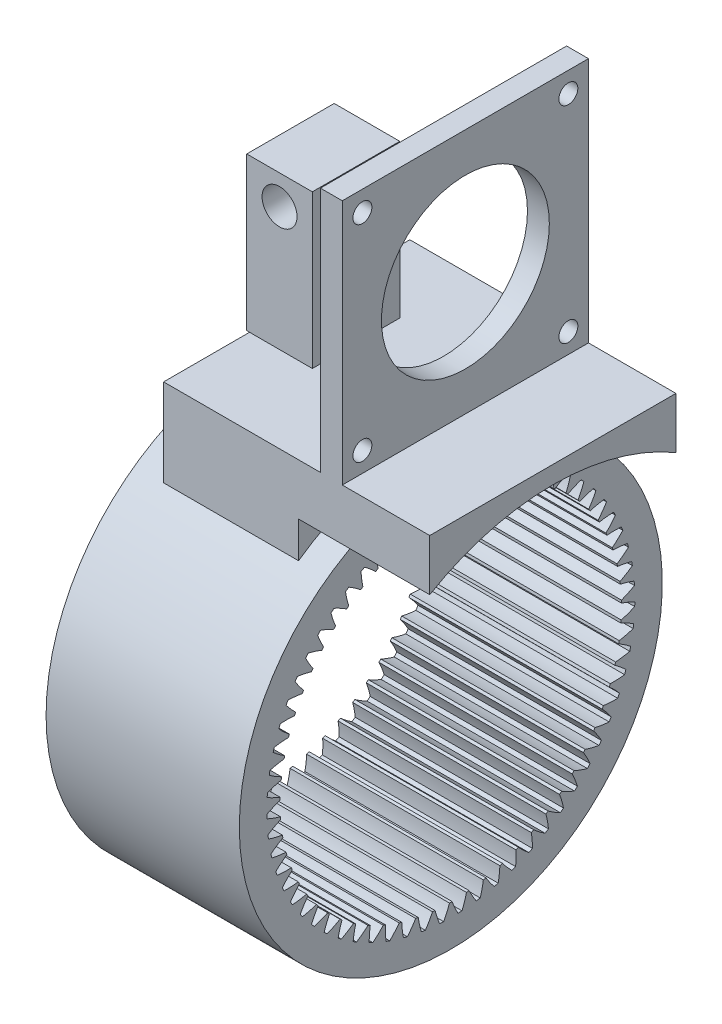
from build123d import *

# Parameters (mm, degrees)
BASPROSKE_W         = 32.815
BASPROSKE_H         = 2.2764
TOOTHCUT_DEPTH      = 56.074954552
TEETHCUTS_COUNT     = 63
SCALE1_SCALE        = 2
SKETCH2_R           = 72.5528
SKETCH2_R_2         = 62.5528
BOSS_EXTRUDE1_DEPTH = 65.63
SCALE2_SCALE        = 1.1
SCALE3_SCALE        = 1.01
SCALE4_SCALE        = 0.99009901
SCALE5_SCALE        = 0.909090909
SCALE6_SCALE        = 1.01
SKETCH3_R           = 73.278328
SKETCH3_R_2         = 72.5528
CUT_EXTRUDE1_DEPTH  = 124.017479557
BOSS_EXTRUDE2_START = -46.2863
BOSS_EXTRUDE2_DEPTH = 46.2863
SCALE7_SCALE        = 0.666666667
BOSS_EXTRUDE3_DEPTH = 30
SKETCH18_W          = 56.3
SKETCH18_H          = 56.3
SKETCH18_R          = 2.165
SKETCH18_R_2        = 19.2
BOSS_EXTRUDE4_DEPTH = 5
SKETCH19_W          = 15
SKETCH19_H          = 35
SKETCH19_R          = 4
BOSS_EXTRUDE5_DEPTH = 10


with BuildPart() as part:
    # BasProSke → Base-Revolve (revolve)
    with BuildSketch(Plane(origin=(0, 0, 0), x_dir=(1, 0, 0), z_dir=(0, 1, 0))):
        with Locations((16.4075, 30.1382)):
            Rectangle(BASPROSKE_W, BASPROSKE_H)
    revolve(axis=Axis((-10, 0, 0), (1, 0, 0)))

    # TooCutSke → ToothCut (cut, through all)
    with BuildSketch(Plane(origin=(0, 0, 0), x_dir=(0, 0, -1), z_dir=(1, 0, 0))):
        with BuildLine():
            ThreePointArc((1.227357706, 28.948593027), (0.830805794, 30.117149174), (0.339543276, 31.24915537))
            ThreePointArc((0.339543276, 31.24915537), (0, 31.251), (-0.339543276, 31.24915537))
            ThreePointArc((-0.339543276, 31.24915537), (-0.830805794, 30.117149174), (-1.227357706, 28.948593027))
            ThreePointArc((-1.227357706, 28.948593027), (0, 28.9746), (1.227357706, 28.948593027))
        make_face()
    toothcut = extrude(amount=TOOTHCUT_DEPTH, mode=Mode.SUBTRACT)

    # TeethCuts: ToothCut ×63 about axis
    teethcuts_axis = Axis((-10, 0, 0), (1, 0, 0))
    for i in range(1, TEETHCUTS_COUNT):
        add(toothcut.rotate(teethcuts_axis, i * 360 / TEETHCUTS_COUNT), mode=Mode.SUBTRACT)


with BuildPart() as part_1:
    # Scale1: scaled about (16.4075, 0, 0)
    add(part.part.scale(SCALE1_SCALE).moved(Location((-16.4075, 0, 0))))

    # Sketch2 → Boss-Extrude1 (add)
    with BuildSketch(Plane(origin=(49.2225, 0, 0), x_dir=(0, 0, -1), z_dir=(1, 0, 0))):
        Circle(SKETCH2_R)
        Circle(SKETCH2_R_2, mode=Mode.SUBTRACT)
    extrude(amount=-BOSS_EXTRUDE1_DEPTH)


with BuildPart() as part_2:
    # Scale2: scaled about (16.4075, 0, 0)
    add(part_1.part.scale(SCALE2_SCALE).moved(Location((-1.64075, 0, 0))))


with BuildPart() as part_3:
    # Scale3: scaled about (16.4075, 0, 0)
    add(part_2.part.scale(SCALE3_SCALE).moved(Location((-0.164075, 0, 0))))


with BuildPart() as part_4:
    # Scale4: scaled about (16.4075, 0, 0)
    add(part_3.part.scale(SCALE4_SCALE).moved(Location((0.162450495, 0, 0))))


with BuildPart() as part_5:
    # Scale5: scaled about (16.4075, 0, 0)
    add(part_4.part.scale(SCALE5_SCALE).moved(Location((1.491590909, 0, 0))))


with BuildPart() as part_6:
    # Scale6: scaled about (16.4075, 0, 0)
    add(part_5.part.scale(SCALE6_SCALE).moved(Location((-0.164075, 0, 0))))

    # Sketch3 → Cut-Extrude1 (cut, through all)
    with BuildSketch(Plane.ZY.offset(16.73565)):
        Circle(SKETCH3_R)
        Circle(SKETCH3_R_2, mode=Mode.SUBTRACT)
    extrude(amount=-CUT_EXTRUDE1_DEPTH, mode=Mode.SUBTRACT)

    # Sketch4 → Boss-Extrude2 (add)
    with BuildSketch(Plane(origin=(39.55065, 0, 0), x_dir=(0, 0, -1), z_dir=(1, 0, 0)).offset(BOSS_EXTRUDE2_START)):
        with BuildLine():
            Line((-42.225, 88.999645447), (-42.225, 58.999645447))
            ThreePointArc((-42.225, 58.999645447), (0, 72.5528), (42.225, 58.999645447))
            Line((42.225, 58.999645447), (42.225, 88.999645447))
            Line((42.225, 88.999645447), (-42.225, 88.999645447))
        make_face()
    extrude(amount=BOSS_EXTRUDE2_DEPTH)


with BuildPart() as part_7:
    # Scale7: scaled about (16.4075, 15.874619557, 0)
    add(part_6.part.scale(SCALE7_SCALE).moved(Location((5.469166667, 5.291539852, 0))))

    # Sketch17 → Boss-Extrude3 (add)
    with BuildSketch(Plane(origin=(31.836266667, 0, 0), x_dir=(0, 0, -1), z_dir=(1, 0, 0))):
        with BuildLine():
            Line((-28.15, 52.896609404), (-28.15, 64.624636817))
            Line((-28.15, 64.624636817), (28.15, 64.624636817))
            Line((28.15, 64.624636817), (28.15, 52.896609404))
            ThreePointArc((28.15, 52.896609404), (0, 60.596739852), (-28.15, 52.896609404))
        make_face()
    extrude(amount=BOSS_EXTRUDE3_DEPTH)

    # Sketch18 → Boss-Extrude4 (add)
    with BuildSketch(Plane(origin=(41.836266667, 0, 0), x_dir=(0, 0, -1), z_dir=(1, 0, 0))):
        with Locations((0, 92.774636817)):
            Rectangle(SKETCH18_W, SKETCH18_H)
        with Locations((-23.55, 116.277331248)):
            Circle(SKETCH18_R, mode=Mode.SUBTRACT)
        with Locations((23.55, 116.277331248)):
            Circle(SKETCH18_R, mode=Mode.SUBTRACT)
        with Locations((-23.55, 69.177331248)):
            Circle(SKETCH18_R, mode=Mode.SUBTRACT)
        with Locations((23.55, 69.177331248)):
            Circle(SKETCH18_R, mode=Mode.SUBTRACT)
        with Locations((0, 92.727331248)):
            Circle(SKETCH18_R_2, mode=Mode.SUBTRACT)
    extrude(amount=-BOSS_EXTRUDE4_DEPTH)

    # Sketch19 → Boss-Extrude5 (add, symmetric)
    with BuildSketch(Plane.XY.offset(-1.5)):
        with Locations((7.836266667, 82.124636817)):
            Rectangle(SKETCH19_W, SKETCH19_H)
        with Locations((7.836266667, 92.918540717)):
            Circle(SKETCH19_R, mode=Mode.SUBTRACT)
    extrude(amount=BOSS_EXTRUDE5_DEPTH, both=True)


solid = part_7.part
